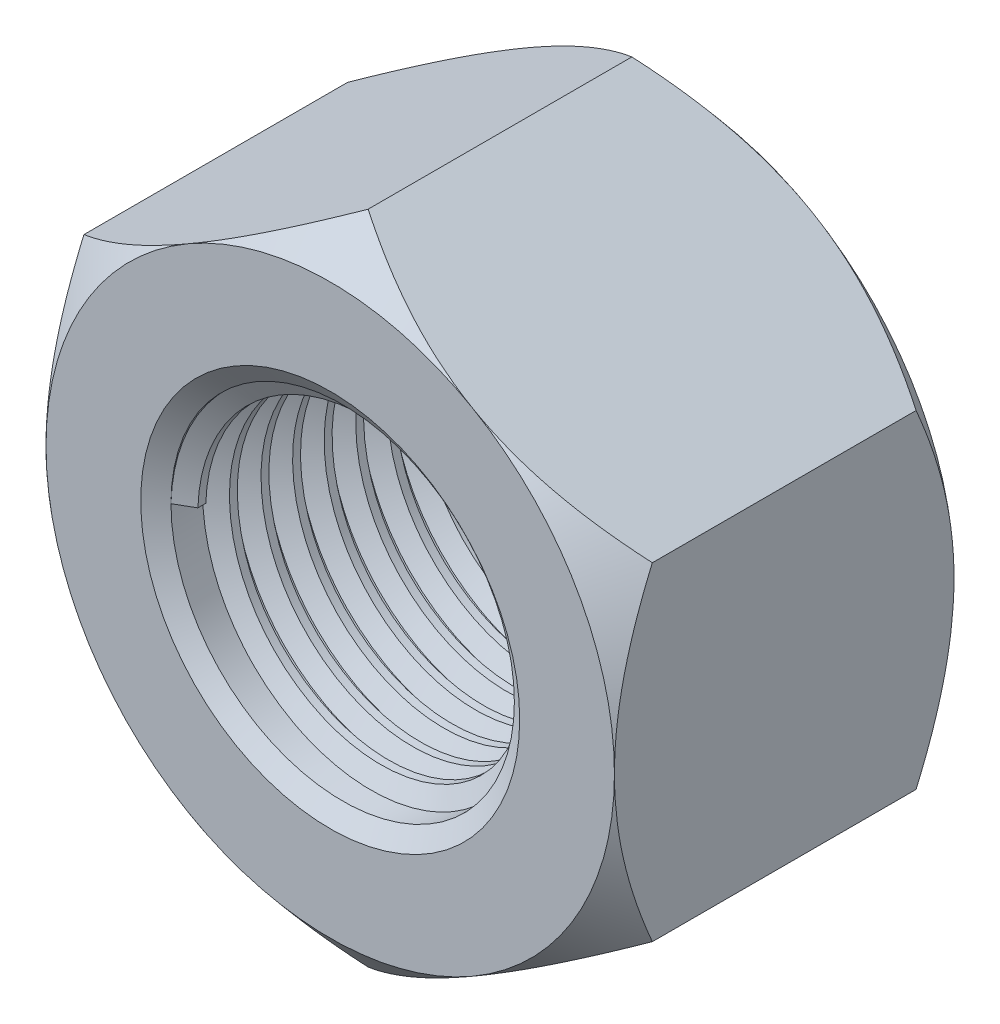
from build123d import *
from build123d.topology import SkipClean

# Parameters (mm, degrees)
BASENUTSKE_R  = 5.75437
BASENUT_DEPTH = 11.3792
THREAD1_PITCH = 1.058333333


with BuildPart() as part:
    # BaseNutSke → BaseNut (new body)
    with BuildSketch(Plane.XY):
        Polygon((9.525, 5.499261314), (9.525, -5.499261314), (0, -10.998522628), (-9.525, -5.499261314), (-9.525, 5.499261314), (0, 10.998522628), align=None)
        Circle(BASENUTSKE_R, mode=Mode.SUBTRACT)
    extrude(amount=-BASENUT_DEPTH)

    # Sketch3 → Double-Chamfer (revolve, cut)
    with BuildSketch(Plane(origin=(0, 0, 0), x_dir=(0, 0, -1), z_dir=(1, 0, 0))):
        Polygon((11.3792, 9.525), (10.1092, 10.998522628), (10.1092, 23.698522628), (24.0792, 23.698522628), (24.0792, 9.525), align=None)
        Polygon((1.27, 23.698522628), (-12.7, 23.698522628), (-12.7, 9.525), (0, 9.525), (1.27, 10.998522628), align=None)
    revolve(axis=Axis((0, 0, 0), (0, 0, -1)), mode=Mode.SUBTRACT)

    # Sketch5 → EndChamfer (revolve, cut)
    with BuildSketch(Plane(origin=(0, 0, 0), x_dir=(0, 0, -1), z_dir=(1, 0, 0)), mode=Mode.PRIVATE) as endchamfer_sk:
        Polygon((11.3538, 6.35), (10.895028922, 5.694807), (11.4046, 5.694807), (11.4046, 6.35), align=None)
        Polygon((-0.0508, 6.35), (0, 6.35), (0.458771078, 5.694807), (-0.0508, 5.694807), align=None)
    revolve(endchamfer_sk.sketch.rotate(Axis((0, 0, -25.037505729), (0, 0, -1)), 90), axis=Axis((0, 0, -25.037505729), (0, 0, -1)), mode=Mode.SUBTRACT)

    # Thread1: the profile of Thread Profile1 profile screwed along a right-hand helix of 9.12 turns, 8 arcs to a turn; built about Z, then put on its axis
    with SkipClean():  # the faces are left unmerged after this step: merging them gives an invalid solid
        thread1_z = Axis((0, 0, 0), (0, 0, 1))
        thread1_corners = [(5.75467, 0, -0.000173205), (5.75467, 0, 0.926214869), (5.181530282, 0, 0.595312499), (5.181530282, 0, 0.330729165)]
        with BuildLine(mode=Mode.PRIVATE) as thread1_profile:
            Line(thread1_corners[0], thread1_corners[1])
            Line(thread1_corners[1], thread1_corners[2])
            Line(thread1_corners[2], thread1_corners[3])
            Line(thread1_corners[3], thread1_corners[0])
        thread1_cap = Face(thread1_profile.wire())
        thread1_turn_angles = [0, 22.5, 45, 67.5, 90, 112.5, 135, 157.5, 180, 202.5, 225, 247.5, 270, 292.5, 315, 337.5, 360]
        thread1_turn_weights = [1, 0.9238795325112867, 1, 0.9238795325112867, 1, 0.9238795325112867, 1, 0.9238795325112867, 1, 0.9238795325112867, 1, 0.9238795325112867, 1, 0.9238795325112867, 1, 0.9238795325112867, 1]
        thread1_turn_rails = [Edge.make_bspline([Vector(p[0], p[1], 0).rotate(thread1_z, thread1_turn_angles[k]) / thread1_turn_weights[k] + Vector(0, 0, p[2] + THREAD1_PITCH * thread1_turn_angles[k] / 360) for k in range(17)], [0, 0, 0, 1, 1, 2, 2, 3, 3, 4, 4, 5, 5, 6, 6, 7, 7, 8, 8, 8], 2, thread1_turn_weights) for p in thread1_corners]
        thread1_turn_sides = [Face.make_surface_from_curves(thread1_turn_rails[p[0]], thread1_turn_rails[p[1]]) for p in [(0, 1), (1, 2), (2, 3), (3, 0)]]
        thread1_last_angles = [3240, 3261.6, 3283.2]
        thread1_last_weights = [1, 0.9297764858882506, 1]
        thread1_last_rails = [Edge.make_bspline([Vector(p[0], p[1], 0).rotate(thread1_z, thread1_last_angles[k]) / thread1_last_weights[k] + Vector(0, 0, p[2] + THREAD1_PITCH * thread1_last_angles[k] / 360) for k in range(3)], [0, 0, 0, 1, 1, 1], 2, thread1_last_weights) for p in thread1_corners]
        thread1_last_sides = [Face.make_surface_from_curves(thread1_last_rails[p[0]], thread1_last_rails[p[1]]) for p in [(0, 1), (1, 2), (2, 3), (3, 0)]]
        thread1 = Plane(origin=(0, 0, -0.417064616), x_dir=(-1, 0, 0), z_dir=(0, 0, -1)) * Solid(Shell([*[p.moved(Location((0, 0, THREAD1_PITCH * i))) for i in range(9) for p in thread1_turn_sides], *thread1_last_sides, thread1_cap, thread1_cap.rotate(thread1_z, 3283.2).moved(Location((0, 0, THREAD1_PITCH * 3283.2 / 360)))]))
        add(thread1)


solid = part.part
